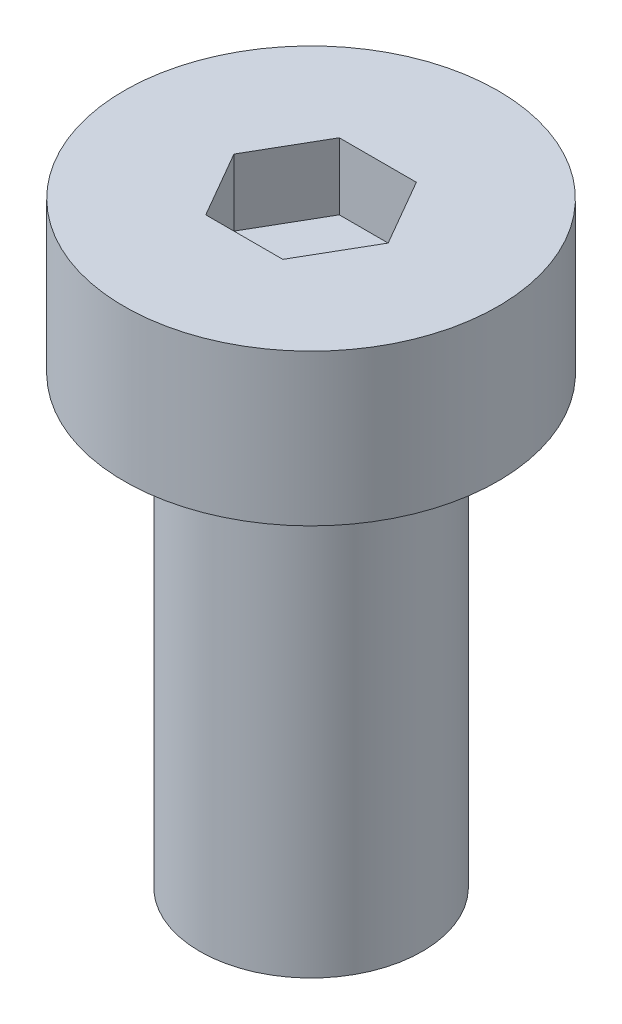
from build123d import *

# Parameters (mm, degrees)
SKETCH1_R           = 2.5
BOSS_EXTRUDE1_DEPTH = 10
SKETCH3_W           = 4.2
SKETCH3_H           = 3.4
CUT_EXTRUDE1_DEPTH  = 1.5


with BuildPart() as part:
    # Sketch1 → Boss-Extrude1 (new body)
    with BuildSketch(Plane(origin=(0, 0, 0), x_dir=(1, 0, 0), z_dir=(0, 1, 0))):
        Circle(SKETCH1_R)
    extrude(amount=BOSS_EXTRUDE1_DEPTH)

    # Sketch3 → Revolve2 (revolve)
    with BuildSketch(Plane.XY):
        with Locations((-2.1, 11.7)):
            Rectangle(SKETCH3_W, SKETCH3_H)
    revolve(axis=Axis((0, 10, 0), (0, 1, 0)))

    # Sketch4 → Cut-Extrude1 (cut)
    with BuildSketch(Plane(origin=(0, 13.4, 0), x_dir=(1, 0, 0), z_dir=(0, 1, 0))):
        Polygon((1.732050808, 0), (0.866025404, 1.5), (-0.866025404, 1.5), (-1.732050808, 0), (-0.866025404, -1.5), (0.866025404, -1.5), align=None)
    extrude(amount=-CUT_EXTRUDE1_DEPTH, mode=Mode.SUBTRACT)


solid = part.part
